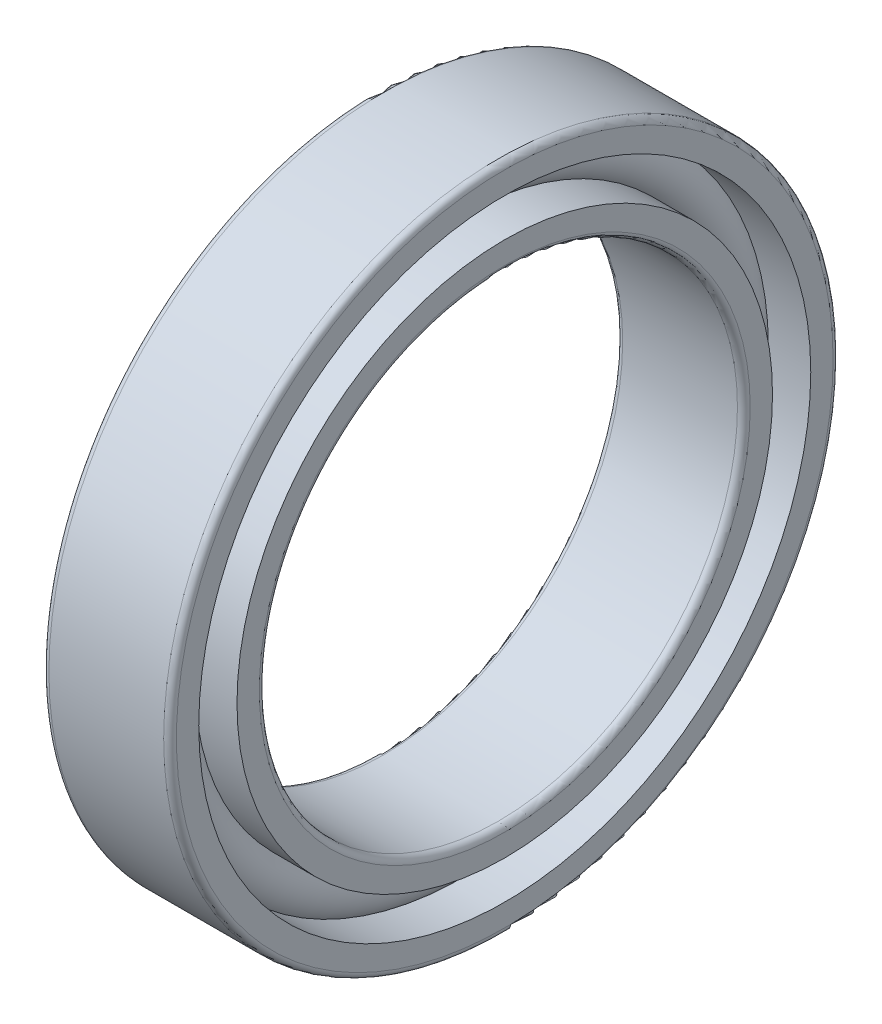
from build123d import *

# Parameters (mm, degrees)
CAGSPISKE_W     = 0.18
CAGSPISKE_H     = 0.3
CAGESPINE_ANGLE = 0.001
BALSIMSKE_R     = 0.9


with BuildPart() as part:
    # CagSpiSke → CageSpine (revolve)
    with BuildSketch(Plane.XY):
        with Locations((0, 9)):
            Rectangle(CAGSPISKE_W, CAGSPISKE_H)
    revolve(axis=Axis((-20.6375, 0, 0), (-1, 0, 0)), revolution_arc=CAGESPINE_ANGLE)

    # BalSimSke → BallsSimplified (revolve)
    with BuildSketch(Plane.XY):
        with Locations((0, 9)):
            Circle(BALSIMSKE_R)
    revolve(axis=Axis((-10, 0, 0), (1, 0, 0)))

    # InnRacSke → InnerRace (revolve)
    with BuildSketch(Plane.XY):
        with BuildLine():
            Line((-0.63688696, 8.4), (-2, 8.4))
            Line((-2, 8.4), (-2, 7.7))
            ThreePointArc((-2, 7.7), (-1.941421356, 7.558578644), (-1.8, 7.5))
            Line((-1.8, 7.5), (1.8, 7.5))
            ThreePointArc((1.8, 7.5), (1.941421356, 7.558578644), (2, 7.7))
            Line((2, 7.7), (2, 8.4))
            Line((2, 8.4), (0.63688696, 8.4))
            ThreePointArc((0.63688696, 8.4), (0, 8.125), (-0.63688696, 8.4))
        make_face()
    revolve(axis=Axis((-20.6375, 0, 0), (1, 0, 0)))

    # OutRacSke → OuterRace (revolve)
    with BuildSketch(Plane.XY):
        with BuildLine():
            Line((-0.63688696, 9.6), (-2, 9.6))
            Line((-2, 9.6), (-2, 10.3))
            ThreePointArc((-2, 10.3), (-1.941421356, 10.441421356), (-1.8, 10.5))
            Line((-1.8, 10.5), (1.8, 10.5))
            ThreePointArc((1.8, 10.5), (1.941421356, 10.441421356), (2, 10.3))
            Line((2, 10.3), (2, 9.6))
            Line((2, 9.6), (0.63688696, 9.6))
            ThreePointArc((0.63688696, 9.6), (0, 9.875), (-0.63688696, 9.6))
        make_face()
    revolve(axis=Axis((-20.6375, 0, 0), (1, 0, 0)))


solid = part.part
